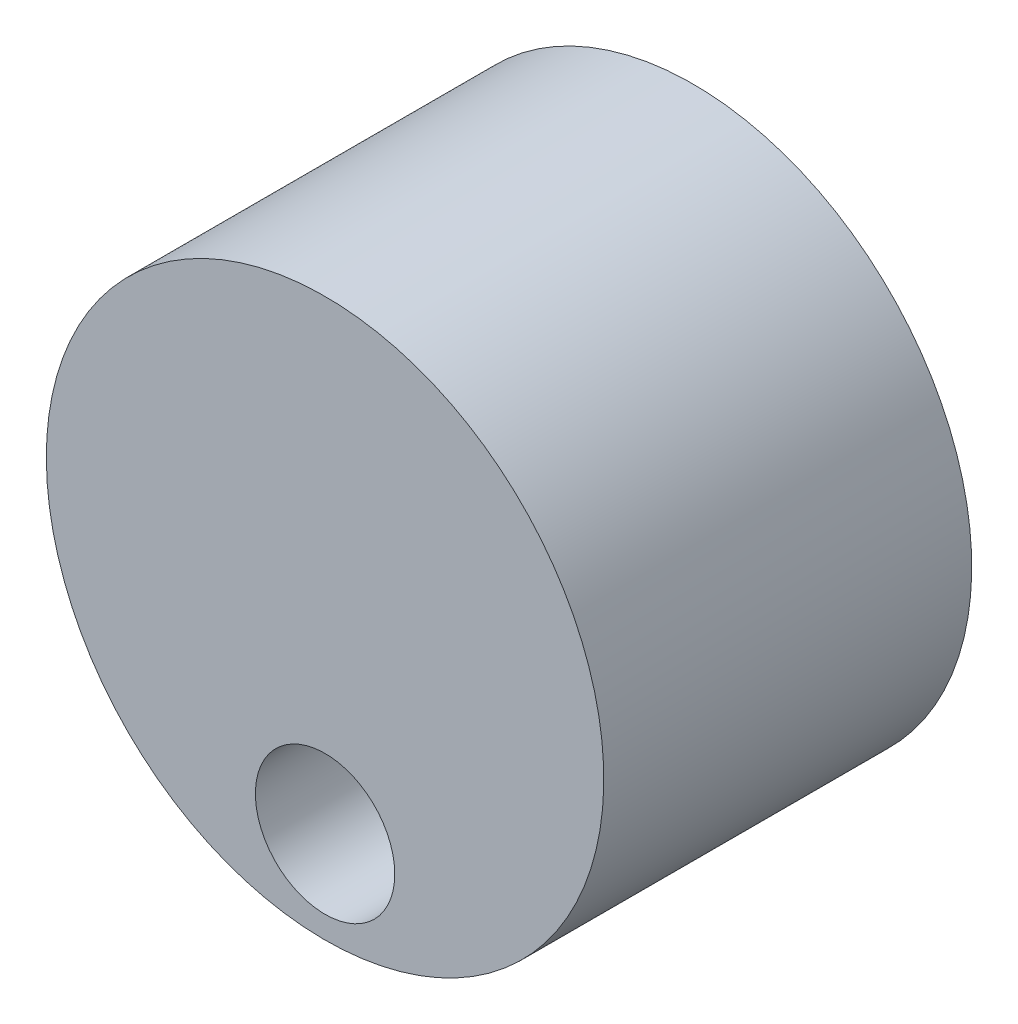
from build123d import *

# Parameters (mm, degrees)
ESQUISSE1_RX       = 12.7
ESQUISSE1_RY       = 12.7
ESQUISSE1_RX_2     = 3.175
ESQUISSE1_RY_2     = 3.175
BOSS_EXTRU_1_DEPTH = 16.764


with BuildPart() as part:
    # Esquisse1 → Boss.-Extru.1 (new body)
    with BuildSketch(Plane.XY):
        with Locations(Location((0, 0), (0, 0, 63.038901355))):
            Ellipse(ESQUISSE1_RX, ESQUISSE1_RY)
        with Locations(Location((0, -8.509), (0, 0, 124.414368361))):
            Ellipse(ESQUISSE1_RX_2, ESQUISSE1_RY_2, mode=Mode.SUBTRACT)
    extrude(amount=BOSS_EXTRU_1_DEPTH)


solid = part.part
